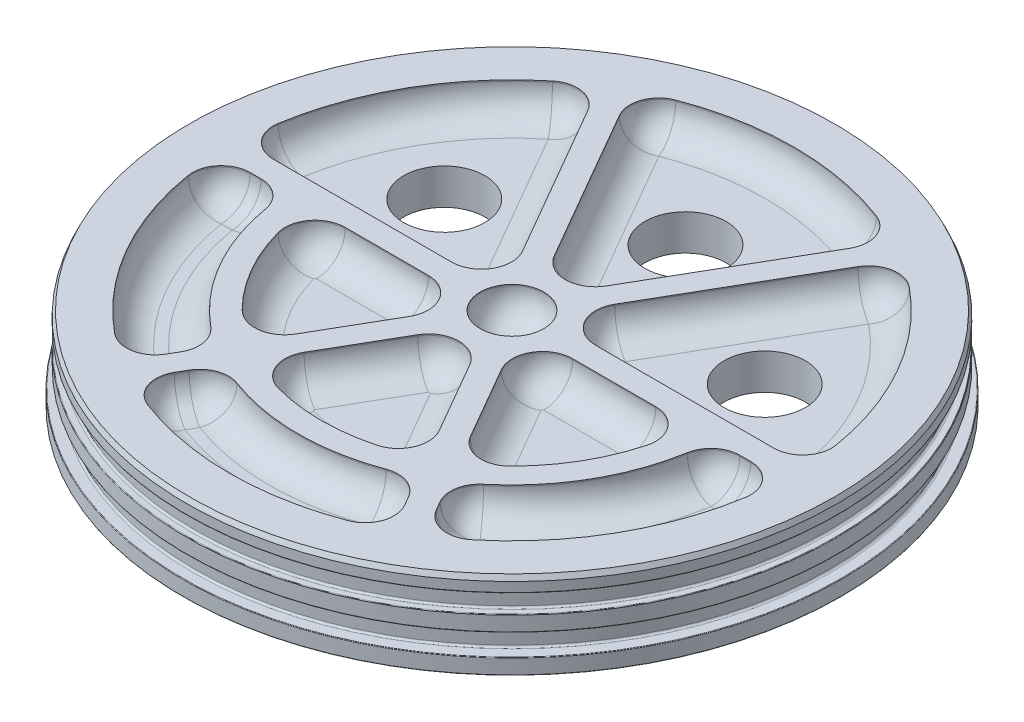
from build123d import *

# Parameters (mm, degrees)
SKETCH6_R                                = 66.04
BOSS_EXTRUDE1_DEPTH                      = 2.54
CNC_ID_FILLET_R                          = 0.4064
CNC_OD_FILLET_R                          = 0.127
CNC_CHAMFERS_SIZE                        = 0.508
CNC_CHAMFERS_SIZE2                       = 1.089409516
PIPE_TAP_DRILL_FOR_1_2_TAP_FILL_VALVE_D  = 17.8562
PIPE_TAP_DRILL_FOR_1_4_TAP_SOLENOID_VA_D = 17.8562
PIPE_TAP_DRILL_FOR_1_2_TAP_CRYO_VALVE_D  = 17.8562
BOSS_EXTRUDE2_REACH                      = 106.472
SKETCH19_R                               = 6.985
FILLET2_R                                = 6.35
SKETCH22_R                               = 8.9281
SKETCH22_R_2                             = 6.985
CUT_EXTRUDE1_DEPTH                       = 6.35
FILLET3_R                                = 6.35


with BuildPart() as part:
    # Sketch1 → Revolve1 (revolve)
    with BuildSketch(Plane.XY, mode=Mode.PRIVATE) as revolve1_sk:
        Polygon((0, 0), (72.39, 0), (72.39, 3.429), (69.6468, 3.429), (69.6468, 7.493), (71.4248, 7.493), (71.4248, 10.922), (69.6468, 10.922), (69.6468, 14.986), (71.4248, 14.986), (71.4248, 18.288), (62.0268, 18.288), (62.0268, 11.684), (0, 11.684), align=None)
    revolve(revolve1_sk.sketch.rotate(Axis((0, 48.192213231, 0), (0, -1, 0)), 180), axis=Axis((0, 48.192213231, 0), (0, -1, 0)))

    # Sketch6 → Boss-Extrude1 (add)
    with BuildSketch(Plane.XZ):
        Circle(SKETCH6_R)
    extrude(amount=BOSS_EXTRUDE1_DEPTH)

    # CNC ID Fillet
    cnc_id_fillet_edges = [part.edges().sort_by_distance(p)[0] for p in [
        (69.6468, 14.986, 0),
        (69.6468, 10.922, 0),
        (69.6468, 7.493, 0),
        (69.6468, 3.429, 0),
        (-66.04, 0, 0),
    ]]
    fillet(cnc_id_fillet_edges, radius=CNC_ID_FILLET_R)

    # CNC OD Fillet
    cnc_od_fillet_edges = [part.edges().sort_by_distance(p)[0] for p in [
        (71.4248, 14.986, 0),
        (71.4248, 10.922, 0),
        (71.4248, 7.493, 0),
        (72.39, 3.429, 0),
        (72.39, 0, 0),
        (-66.04, -2.54, 0),
    ]]
    fillet(cnc_od_fillet_edges, radius=CNC_OD_FILLET_R)

    # CNC Chamfers
    cnc_chamfers_edges = [part.edges().sort_by_distance(p)[0] for p in [
        (71.4248, 18.288, 0),
    ]]
    cnc_chamfers_side = [part.faces().sort_by_distance(p)[0] for p in [
        (69.404601583, 18.288, 0),
    ]]
    chamfer(cnc_chamfers_edges, length=CNC_CHAMFERS_SIZE, length2=CNC_CHAMFERS_SIZE2, reference=cnc_chamfers_side[0])

    # Pipe Tap Drill for 1/2 Tap - Fill Valve (through all)
    with Locations(Plane(origin=(0, -2.54, 0), x_dir=(-1, 0, 0), z_dir=(0, -1, 0))):
        with Locations((0, 38.1)):
            Hole(PIPE_TAP_DRILL_FOR_1_2_TAP_FILL_VALVE_D / 2)

    # Pipe Tap Drill for 1/4 Tap - Solenoid Valve (through all)
    with Locations(Plane(origin=(0, -2.54, 0), x_dir=(-1, 0, 0), z_dir=(0, -1, 0))):
        with Locations((-35.19527241, 20.32)):
            Hole(PIPE_TAP_DRILL_FOR_1_4_TAP_SOLENOID_VA_D / 2)

    # Pipe Tap Drill for 1/2 Tap - Cryo Valve (through all)
    with Locations(Plane(origin=(0, -2.54, 0), x_dir=(-1, 0, 0), z_dir=(0, -1, 0))):
        with Locations((35.19527241, 20.32)):
            Hole(PIPE_TAP_DRILL_FOR_1_2_TAP_CRYO_VALVE_D / 2)

    # Sketch19 → Boss-Extrude2 (add, up to next)
    with BuildSketch(Plane(origin=(0, 18.288, 0), x_dir=(1, 0, 0), z_dir=(0, 1, 0)), mode=Mode.PRIVATE) as boss_extrude2_sk1:
        with BuildLine():
            ThreePointArc((5.719231767, 14.986), (0, 11.684), (-5.719231767, 14.986))
            Line((-5.719231767, 14.986), (-28.787681288, 54.941726623))
            ThreePointArc((-28.787681288, 54.941726623), (-31.0134, 53.716784515), (-33.187090339, 52.401726623))
            Line((-33.187090339, 52.401726623), (-10.118640818, 12.446))
            ThreePointArc((-10.118640818, 12.446), (-10.118640818, 5.842), (-15.837872584, 2.54))
            Line((-15.837872584, 2.54), (-61.974771627, 2.54))
            ThreePointArc((-61.974771627, 2.54), (-62.0268, 0), (-61.974771627, -2.54))
            Line((-61.974771627, -2.54), (-46.921301133, -2.54))
            ThreePointArc((-46.921301133, -2.54), (-40.694533724, -23.495), (-25.660355092, -39.36503876))
            Line((-25.660355092, -39.36503876), (-33.187090339, -52.401726623))
            ThreePointArc((-33.187090339, -52.401726623), (-31.0134, -53.716784515), (-28.787681288, -54.941726623))
            Line((-28.787681288, -54.941726623), (-21.260946041, -41.90503876))
            ThreePointArc((-21.260946041, -41.90503876), (0, -46.99), (21.260946041, -41.90503876))
            Line((21.260946041, -41.90503876), (28.787681288, -54.941726623))
            ThreePointArc((28.787681288, -54.941726623), (31.0134, -53.716784515), (33.187090339, -52.401726623))
            Line((33.187090339, -52.401726623), (25.660355092, -39.36503876))
            ThreePointArc((25.660355092, -39.36503876), (40.694533724, -23.495), (46.921301133, -2.54))
            Line((46.921301133, -2.54), (61.974771627, -2.54))
            ThreePointArc((61.974771627, -2.54), (62.013791543, -1.270266404), (62.0268, 0))
            ThreePointArc((62.0268, 0), (62.013791543, 1.270266404), (61.974771627, 2.54))
            Line((61.974771627, 2.54), (15.837872584, 2.54))
            ThreePointArc((15.837872584, 2.54), (10.118640818, 5.842), (10.118640818, 12.446))
            Line((10.118640818, 12.446), (33.187090339, 52.401726623))
            ThreePointArc((33.187090339, 52.401726623), (31.0134, 53.716784515), (28.787681288, 54.941726623))
            Line((28.787681288, 54.941726623), (5.719231767, 14.986))
        make_face()
        with BuildLine():
            ThreePointArc((-15.837872584, -2.54), (-10.118640818, -5.842), (-10.118640818, -12.446))
            Line((-10.118640818, -12.446), (-19.250370935, -28.262620524))
            ThreePointArc((-19.250370935, -28.262620524), (-24.108196662, -31.508199896), (-29.640175869, -29.629513571))
            ThreePointArc((-29.640175869, -29.629513571), (-36.295124673, -20.955), (-40.479999389, -10.854388489))
            ThreePointArc((-40.479999389, -10.854388489), (-39.340999868, -5.1242108), (-34.101332819, -2.54))
            Line((-34.101332819, -2.54), (-15.837872584, -2.54))
        make_face(mode=Mode.SUBTRACT)
        with BuildLine():
            ThreePointArc((-5.719231767, -14.986), (0, -11.684), (5.719231767, -14.986))
            Line((5.719231767, -14.986), (14.850961884, -30.802620524))
            ThreePointArc((14.850961884, -30.802620524), (15.232803207, -36.632410696), (10.83982352, -40.483902061))
            ThreePointArc((10.83982352, -40.483902061), (0, -41.91), (-10.83982352, -40.483902061))
            ThreePointArc((-10.83982352, -40.483902061), (-15.232803207, -36.632410696), (-14.850961884, -30.802620524))
            Line((-14.850961884, -30.802620524), (-5.719231767, -14.986))
        make_face(mode=Mode.SUBTRACT)
        with BuildLine():
            ThreePointArc((10.118640818, -12.446), (10.118640818, -5.842), (15.837872584, -2.54))
            Line((15.837872584, -2.54), (34.101332819, -2.54))
            ThreePointArc((34.101332819, -2.54), (39.340999868, -5.1242108), (40.479999389, -10.854388489))
            ThreePointArc((40.479999389, -10.854388489), (34.005434194, -24.496500674), (23.116184272, -34.958405637))
            Line((23.116184272, -34.958405637), (10.118640818, -12.446))
        make_face(mode=Mode.SUBTRACT)
        with Locations(Location((0, 0, 0), (0, 0, 180))):
            Circle(SKETCH19_R, mode=Mode.SUBTRACT)
    boss_extrude2_tool1 = extrude(boss_extrude2_sk1.sketch, amount=-BOSS_EXTRUDE2_REACH, mode=Mode.PRIVATE) - part.part
    add(boss_extrude2_tool1.solids().sort_by_distance((-0.134537, 18.288, 7.729163))[0])

    # Fillet2
    fillet2_edges = [part.edges().sort_by_distance(p)[0] for p in [
        (-53.716784515, 11.684, 31.0134),
        (0, 11.684, 62.0268),
        (53.716784515, 11.684, 31.0134),
        (53.716784515, 11.684, -31.0134),
        (0, 11.684, -62.0268),
        (-53.716784515, 11.684, -31.0134),
        (6.985, 11.684, 0),
        (16.617412545, 11.684, 23.702202819),
        (34.005434194, 11.684, 24.496500674),
        (0, 11.684, 41.91),
        (0, 11.684, 11.684),
        (-10.285096825, 11.684, 22.894310262),
        (-24.108196662, 11.684, 31.508199896),
        (-24.969602701, 11.684, 2.54),
        (-36.295124673, 11.684, 20.955),
        (29.423722716, 11.684, 45.883382691),
        (-25.024313664, 11.684, 48.423382691),
        (-54.44803638, 11.684, 2.54),
        (-10.118640818, 11.684, -5.842),
        (-21.652865579, 11.684, -32.423863311),
        (17.253456527, 11.684, -34.963863311),
        (38.906322106, 11.684, -2.54),
        (15.232803207, 11.684, 36.632410696),
        (10.285096825, 11.684, 22.894310262),
        (-15.232803207, 11.684, 36.632410696),
        (10.118640818, 11.684, 5.842),
        (23.116184272, 14.986, 34.958405637),
        (39.340999868, 11.684, 5.1242108),
        (24.969602701, 11.684, 2.54),
        (25.024313664, 11.684, 48.423382691),
        (28.787681288, 14.986, 54.941726623),
        (0, 11.684, 46.99),
        (21.260946041, 14.986, 41.90503876),
        (-21.260946041, 14.986, 41.90503876),
        (-29.423722716, 11.684, 45.883382691),
        (-33.187090339, 14.986, 52.401726623),
        (-40.694533724, 11.684, 23.495),
        (-25.660355092, 14.986, 39.36503876),
        (-46.921301133, 14.986, 2.54),
        (-38.906322106, 11.684, -2.54),
        (-61.974771627, 14.986, -2.54),
        (-17.253456527, 11.684, -34.963863311),
        (-28.787681288, 14.986, -54.941726623),
        (0, 11.684, -11.684),
        (21.652865579, 11.684, -32.423863311),
        (33.187090339, 14.986, -52.401726623),
        (10.118640818, 11.684, -5.842),
        (54.44803638, 11.684, 2.54),
        (61.974771627, 14.986, 2.54),
        (40.694533724, 11.684, 23.495),
        (46.921301133, 14.986, 2.54),
        (25.660355092, 14.986, 39.36503876),
        (-14.684505876, 11.684, 20.354310262),
        (-10.118640818, 11.684, 5.842),
        (-39.340999868, 11.684, 5.1242108),
        (-61.974771627, 14.986, 2.54),
        (-33.187090339, 14.986, -52.401726623),
        (28.787681288, 14.986, -54.941726623),
        (61.974771627, 14.986, -2.54),
        (33.187090339, 14.986, 52.401726623),
        (-28.787681288, 14.986, 54.941726623),
    ]]
    fillet(fillet2_edges, radius=FILLET2_R)

    # Sketch22 → Cut-Extrude1 (cut)
    # profile 1 of 10: a face of its own
    with BuildSketch(Plane.XZ.offset(2.54)):
        with BuildLine():
            ThreePointArc((-39.19254557, -48.075651738), (-34.0332449, -49.399459047), (-29.680943391, -46.328901969))
            Line((-29.680943391, -46.328901969), (-10.118640818, -12.446))
            ThreePointArc((-10.118640818, -12.446), (-10.118640818, -5.842), (-15.837872584, -2.54))
            Line((-15.837872584, -2.54), (-54.96247773, -2.54))
            ThreePointArc((-54.96247773, -2.54), (-59.797808918, -4.773925133), (-61.231008493, -9.903914234))
            ThreePointArc((-61.231008493, -9.903914234), (-53.716784515, -31.0134), (-39.19254557, -48.075651738))
        make_face()
        with Locations((-35.19527241, -20.32)):
            Circle(SKETCH22_R, mode=Mode.SUBTRACT)
    # profile 2 of 10: a face of its own
    with BuildSketch(Plane.XZ.offset(2.54)):
        with BuildLine():
            ThreePointArc((-40.479999389, 10.854388489), (-39.340999868, 5.1242108), (-34.101332819, 2.54))
            Line((-34.101332819, 2.54), (-15.837872584, 2.54))
            ThreePointArc((-15.837872584, 2.54), (-10.118640818, 5.842), (-10.118640818, 12.446))
            Line((-10.118640818, 12.446), (-19.250370935, 28.262620524))
            ThreePointArc((-19.250370935, 28.262620524), (-24.108196662, 31.508199896), (-29.640175869, 29.629513571))
            ThreePointArc((-29.640175869, 29.629513571), (-36.295124673, 20.955), (-40.479999389, 10.854388489))
        make_face()
    # profile 3 of 10: a face of its own
    with BuildSketch(Plane.XZ.offset(2.54)):
        with BuildLine():
            ThreePointArc((10.118640818, 12.446), (10.118640818, 5.842), (15.837872584, 2.54))
            Line((15.837872584, 2.54), (34.101332819, 2.54))
            ThreePointArc((34.101332819, 2.54), (39.340999868, 5.1242108), (40.479999389, 10.854388489))
            ThreePointArc((40.479999389, 10.854388489), (36.197302153, 21.123527567), (29.363372673, 29.903853351))
            ThreePointArc((29.363372673, 29.903853351), (24.056838661, 31.664796763), (19.4151155, 28.54796648))
            Line((19.4151155, 28.54796648), (10.118640818, 12.446))
        make_face()
    # profile 4 of 10: a face of its own
    with BuildSketch(Plane.XZ.offset(2.54)):
        with BuildLine():
            ThreePointArc((-10.83982352, 40.483902061), (-15.232803207, 36.632410696), (-14.850961884, 30.802620524))
            Line((-14.850961884, 30.802620524), (-5.719231767, 14.986))
            ThreePointArc((-5.719231767, 14.986), (0, 11.684), (5.719231767, 14.986))
            Line((5.719231767, 14.986), (14.850961884, 30.802620524))
            ThreePointArc((14.850961884, 30.802620524), (15.232803207, 36.632410696), (10.83982352, 40.483902061))
            ThreePointArc((10.83982352, 40.483902061), (0, 41.91), (-10.83982352, 40.483902061))
        make_face()
    # profile 5 of 10: a face of its own
    with BuildSketch(Plane.XZ.offset(2.54)):
        with BuildLine():
            ThreePointArc((-29.948804705, 36.209518041), (-27.746356582, 39.977884546), (-28.496679161, 44.277696155))
            Line((-28.496679161, 44.277696155), (-29.680943391, 46.328901969))
            ThreePointArc((-29.680943391, 46.328901969), (-34.0332449, 49.399459047), (-39.19254557, 48.075651738))
            ThreePointArc((-39.19254557, 48.075651738), (-53.716784515, 31.0134), (-61.231008493, 9.903914234))
            ThreePointArc((-61.231008493, 9.903914234), (-59.797808918, 4.773925133), (-54.96247773, 2.54))
            Line((-54.96247773, 2.54), (-52.593949272, 2.54))
            ThreePointArc((-52.593949272, 2.54), (-48.495041897, 4.04010739), (-46.332764835, 7.831666667))
            ThreePointArc((-46.332764835, 7.831666667), (-40.694533724, 23.495), (-29.948804705, 36.209518041))
        make_face()
    # profile 6 of 10: a face of its own
    with BuildSketch(Plane.XZ.offset(2.54)):
        with BuildLine():
            ThreePointArc((16.38396013, 44.041184708), (20.748685315, 44.017991935), (24.09727011, 46.817696155))
            Line((24.09727011, 46.817696155), (25.281534339, 48.868901969))
            ThreePointArc((25.281534339, 48.868901969), (25.764564018, 54.17338418), (22.038462923, 57.979565971))
            ThreePointArc((22.038462923, 57.979565971), (0, 62.0268), (-22.038462923, 57.979565971))
            ThreePointArc((-22.038462923, 57.979565971), (-25.764564018, 54.17338418), (-25.281534339, 48.868901969))
            Line((-25.281534339, 48.868901969), (-24.09727011, 46.817696155))
            ThreePointArc((-24.09727011, 46.817696155), (-20.748685315, 44.017991935), (-16.38396013, 44.041184708))
            ThreePointArc((-16.38396013, 44.041184708), (0, 46.99), (16.38396013, 44.041184708))
        make_face()
    # profile 7 of 10: a face of its own
    with BuildSketch(Plane.XZ.offset(2.54)):
        with BuildLine():
            ThreePointArc((46.332764835, 7.831666667), (48.495041897, 4.04010739), (52.593949272, 2.54))
            Line((52.593949272, 2.54), (54.96247773, 2.54))
            ThreePointArc((54.96247773, 2.54), (59.797808918, 4.773925133), (61.231008493, 9.903914234))
            ThreePointArc((61.231008493, 9.903914234), (53.716784515, 31.0134), (39.19254557, 48.075651738))
            ThreePointArc((39.19254557, 48.075651738), (34.0332449, 49.399459047), (29.680943391, 46.328901969))
            Line((29.680943391, 46.328901969), (28.496679161, 44.277696155))
            ThreePointArc((28.496679161, 44.277696155), (27.746356582, 39.977884546), (29.948804705, 36.209518041))
            ThreePointArc((29.948804705, 36.209518041), (40.694533724, 23.495), (46.332764835, 7.831666667))
        make_face()
    # profile 8 of 10: a face of its own
    with BuildSketch(Plane.XZ.offset(2.54)):
        with BuildLine():
            ThreePointArc((15.837872584, -2.54), (10.118640818, -5.842), (10.118640818, -12.446))
            Line((10.118640818, -12.446), (29.680943391, -46.328901969))
            ThreePointArc((29.680943391, -46.328901969), (34.0332449, -49.399459047), (39.19254557, -48.075651738))
            ThreePointArc((39.19254557, -48.075651738), (53.716784515, -31.0134), (61.231008493, -9.903914234))
            ThreePointArc((61.231008493, -9.903914234), (59.797808918, -4.773925133), (54.96247773, -2.54))
            Line((54.96247773, -2.54), (15.837872584, -2.54))
        make_face()
        with Locations((35.19527241, -20.32)):
            Circle(SKETCH22_R, mode=Mode.SUBTRACT)
    # profile 9 of 10: a face of its own
    with BuildSketch(Plane.XZ.offset(2.54)):
        with BuildLine():
            ThreePointArc((5.719231767, -14.986), (0, -11.684), (-5.719231767, -14.986))
            Line((-5.719231767, -14.986), (-25.281534339, -48.868901969))
            ThreePointArc((-25.281534339, -48.868901969), (-25.764564018, -54.17338418), (-22.038462923, -57.979565971))
            ThreePointArc((-22.038462923, -57.979565971), (0, -62.0268), (22.038462923, -57.979565971))
            ThreePointArc((22.038462923, -57.979565971), (25.764564018, -54.17338418), (25.281534339, -48.868901969))
            Line((25.281534339, -48.868901969), (5.719231767, -14.986))
        make_face()
        with Locations((0, -38.1)):
            Circle(SKETCH22_R, mode=Mode.SUBTRACT)
    # profile 10 of 10: a face of its own
    with BuildSketch(Plane.XZ.offset(2.54)):
        with Locations(Location((0, 0, 0), (0, 0, 180))):
            Circle(SKETCH22_R_2)
    extrude(amount=-CUT_EXTRUDE1_DEPTH, mode=Mode.SUBTRACT)

    # Fillet3
    fillet3_edges = [part.edges().sort_by_distance(p)[0] for p in [
        (59.797808918, 3.81, -4.773925133),
        (53.716784515, 3.81, -31.0134),
        (34.0332449, 3.81, -49.399459047),
        (19.899792104, 3.81, -29.387450985),
        (10.118640818, 3.81, -5.842),
        (-10.118640818, 3.81, -5.842),
        (-19.899792104, 3.81, -29.387450985),
        (-34.0332449, 3.81, -49.399459047),
        (-53.716784515, 3.81, -31.0134),
        (-59.797808918, 3.81, -4.773925133),
        (0, 3.81, -11.684),
        (15.500383053, 3.81, -31.927450985),
        (25.764564018, 3.81, -54.17338418),
        (0, 3.81, -62.0268),
        (-25.764564018, 3.81, -54.17338418),
        (-40.694533724, 3.81, 23.495),
        (-48.495041897, 3.81, 4.04010739),
        (-53.778213501, 3.81, 2.54),
        (-59.797808918, 3.81, 4.773925133),
        (-53.716784515, 3.81, 31.0134),
        (-34.0332449, 3.81, 49.399459047),
        (-29.088811276, 3.81, 45.303299062),
        (-27.746356582, 3.81, 39.977884546),
        (0, 3.81, 46.99),
        (-20.748685315, 3.81, 44.017991935),
        (-24.689402225, 3.81, 47.843299062),
        (-25.764564018, 3.81, 54.17338418),
        (0, 3.81, 62.0268),
        (25.764564018, 3.81, 54.17338418),
        (24.689402225, 3.81, 47.843299062),
        (20.748685315, 3.81, 44.017991935),
        (40.694533724, 3.81, 23.495),
        (27.746356582, 3.81, 39.977884546),
        (29.088811276, 3.81, 45.303299062),
        (34.0332449, 3.81, 49.399459047),
        (53.716784515, 3.81, 31.0134),
        (59.797808918, 3.81, 4.773925133),
        (53.778213501, 3.81, 2.54),
        (48.495041897, 3.81, 4.04010739),
        (14.766878159, 3.81, 20.49698324),
        (24.056838661, 3.81, 31.664796763),
        (36.197302153, 3.81, 21.123527567),
        (39.340999868, 3.81, 5.1242108),
        (24.969602701, 3.81, 2.54),
        (10.118640818, 3.81, 5.842),
        (10.285096825, 3.81, 22.894310262),
        (0, 3.81, 11.684),
        (-10.285096825, 3.81, 22.894310262),
        (-15.232803207, 3.81, 36.632410696),
        (0, 3.81, 41.91),
        (15.232803207, 3.81, 36.632410696),
        (-10.118640818, 3.81, 5.842),
        (-24.969602701, 3.81, 2.54),
        (-39.340999868, 3.81, 5.1242108),
        (-36.295124673, 3.81, 20.955),
        (-24.108196662, 3.81, 31.508199896),
        (-14.684505876, 3.81, 20.354310262),
        (6.985, 3.81, 0),
        (35.400175157, 3.81, -2.54),
        (-35.400175157, 3.81, -2.54),
        (-15.500383053, 3.81, -31.927450985),
    ]]
    fillet(fillet3_edges, radius=FILLET3_R - 0.0001)  # a hair under: the kernel refuses the full size


solid = part.part
